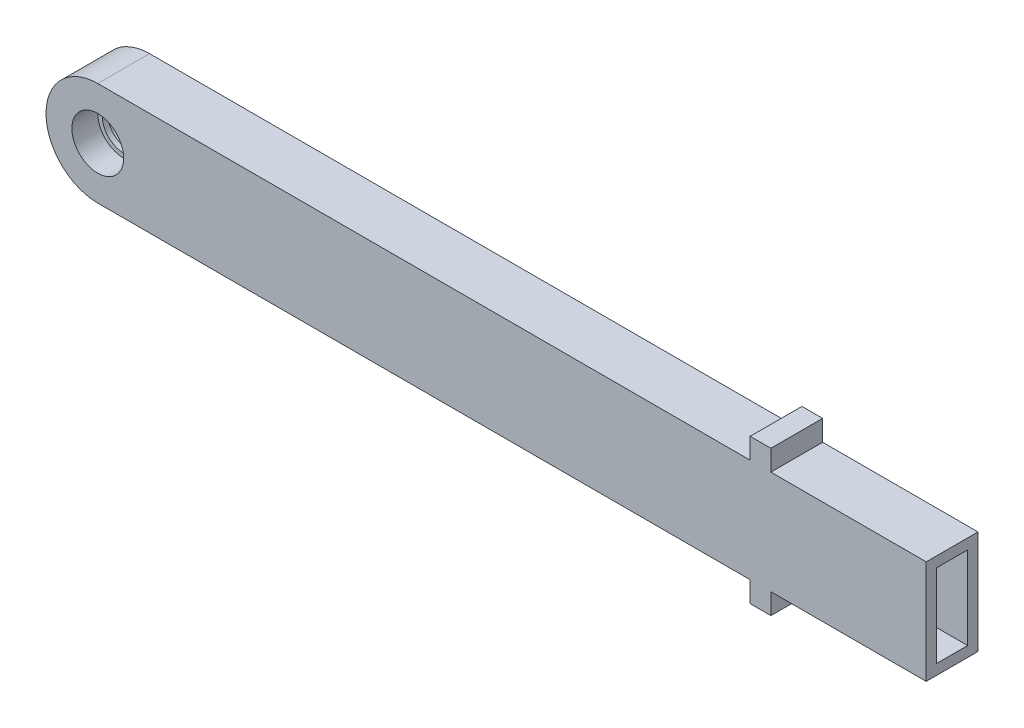
from build123d import *

# Parameters (mm, degrees)
SKETCH1_R           = 2.5
BOSS_EXTRUDE1_DEPTH = 5
SKETCH2_W           = 3
SKETCH2_H           = 8
CUT_EXTRUDE1_DEPTH  = 10
CUT_EXTRUDE2_DEPTH  = 2
SKETCH4_R           = 2.5
SKETCH4_R_2         = 2.072596968
BOSS_EXTRUDE2_DEPTH = 0.5
SKETCH5_W           = 2
SKETCH5_H           = 5
BOSS_EXTRUDE3_DEPTH = 2
SKETCH5_2_W         = 2
SKETCH5_2_H         = 5
BOSS_EXTRUDE4_DEPTH = 12


with BuildPart() as part:
    # Sketch1 → Boss-Extrude1 (new body)
    with BuildSketch(Plane.XY):
        with BuildLine():
            Line((80, -5), (80, 0))
            Line((80, 0), (80, 5))
            Line((80, 5), (0, 5))
            ThreePointArc((0, 5), (-5, 0), (0, -5))
            Line((0, -5), (80, -5))
        make_face()
        Circle(SKETCH1_R, mode=Mode.SUBTRACT)
    extrude(amount=BOSS_EXTRUDE1_DEPTH)

    # Sketch2 → Cut-Extrude1 (cut)
    with BuildSketch(Plane(origin=(80, 0, 0), x_dir=(0, 0, -1), z_dir=(1, 0, 0))):
        with Locations((-2.5, 0)):
            Rectangle(SKETCH2_W, SKETCH2_H)
    extrude(amount=-CUT_EXTRUDE1_DEPTH, mode=Mode.SUBTRACT)

    # Sketch3 → Cut-Extrude2 (cut)
    with BuildSketch(Plane(origin=(0, 0, 0), x_dir=(-1, 0, 0), z_dir=(0, 0, -1))):
        with BuildLine():
            Line((-20, 1.509117449), (0, 2.5))
            ThreePointArc((0, 2.5), (2.5, 0), (0, -2.5))
            Line((0, -2.5), (-20, -1.509117449))
            ThreePointArc((-20, -1.509117449), (-21.509117449, 0), (-20, 1.509117449))
        make_face()
    extrude(amount=-CUT_EXTRUDE2_DEPTH, mode=Mode.SUBTRACT)

    # Sketch4 → Boss-Extrude2 (add)
    with BuildSketch(Plane(origin=(0, 0, 2), x_dir=(-1, 0, 0), z_dir=(0, 0, -1))):
        Circle(SKETCH4_R)
        Circle(SKETCH4_R_2, mode=Mode.SUBTRACT)
    extrude(amount=-BOSS_EXTRUDE2_DEPTH)

    # Sketch5 → Boss-Extrude3 (add)
    with BuildSketch(Plane(origin=(0, 5, 0), x_dir=(1, 0, 0), z_dir=(0, 1, 0))):
        with Locations((64, -2.5)):
            Rectangle(SKETCH5_W, SKETCH5_H)
    extrude(amount=BOSS_EXTRUDE3_DEPTH)

    # Sketch5<2> → Boss-Extrude4 (add)
    with BuildSketch(Plane(origin=(0, 5, 0), x_dir=(1, 0, 0), z_dir=(0, 1, 0))):
        with Locations((64, -2.5)):
            Rectangle(SKETCH5_2_W, SKETCH5_2_H)
    extrude(amount=-BOSS_EXTRUDE4_DEPTH)


solid = part.part
